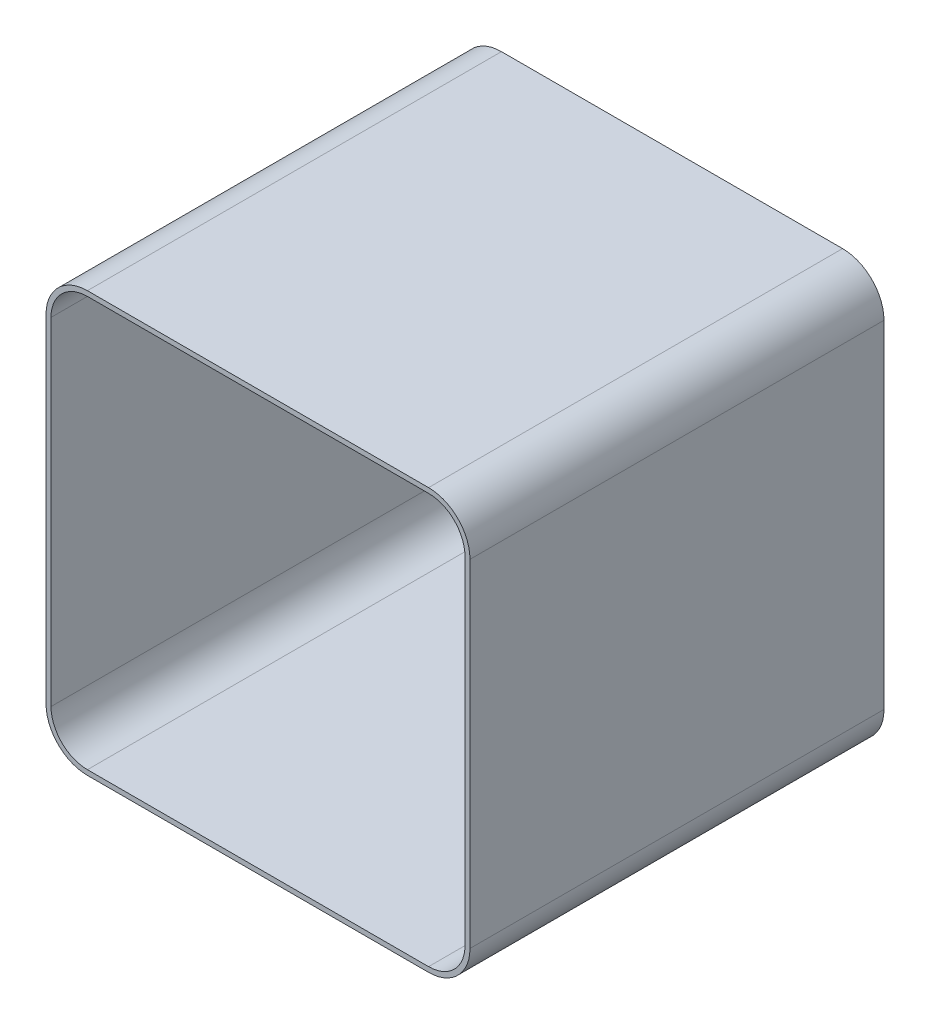
from build123d import *

# Parameters (mm, degrees)
EXTRUDE_THIN1_DEPTH = 500


with BuildPart() as part:
    # Sketch1 → Extrude-Thin1 (new body)
    with BuildSketch(Plane.XY):
        with BuildLine():
            Line((53.165339655, -68.75017884), (-358.834660345, -68.75017884))
            ThreePointArc((-358.834660345, -68.75017884), (-394.189999405, -54.105517899), (-408.834660345, -18.75017884))
            Line((-408.834660345, -18.75017884), (-408.834660345, 388.24982116))
            ThreePointArc((-408.834660345, 388.24982116), (-394.189999405, 423.60516022), (-358.834660345, 438.24982116))
            Line((-358.834660345, 438.24982116), (53.165339655, 438.24982116))
            ThreePointArc((53.165339655, 438.24982116), (88.520678714, 423.60516022), (103.165339655, 388.24982116))
            Line((103.165339655, 388.24982116), (103.165339655, -18.75017884))
            ThreePointArc((103.165339655, -18.75017884), (88.520678714, -54.105517899), (53.165339655, -68.75017884))
        make_face()
        with BuildLine():
            Line((53.165339655, -62.75017884), (-358.834660345, -62.75017884))
            ThreePointArc((-358.834660345, -62.75017884), (-389.947358718, -49.862877212), (-402.834660345, -18.75017884))
            Line((-402.834660345, -18.75017884), (-402.834660345, 388.24982116))
            ThreePointArc((-402.834660345, 388.24982116), (-389.947358718, 419.362519533), (-358.834660345, 432.24982116))
            Line((-358.834660345, 432.24982116), (53.165339655, 432.24982116))
            ThreePointArc((53.165339655, 432.24982116), (84.278038027, 419.362519533), (97.165339655, 388.24982116))
            Line((97.165339655, 388.24982116), (97.165339655, -18.75017884))
            ThreePointArc((97.165339655, -18.75017884), (84.278038027, -49.862877212), (53.165339655, -62.75017884))
        make_face(mode=Mode.SUBTRACT)
    extrude(amount=EXTRUDE_THIN1_DEPTH)


solid = part.part
